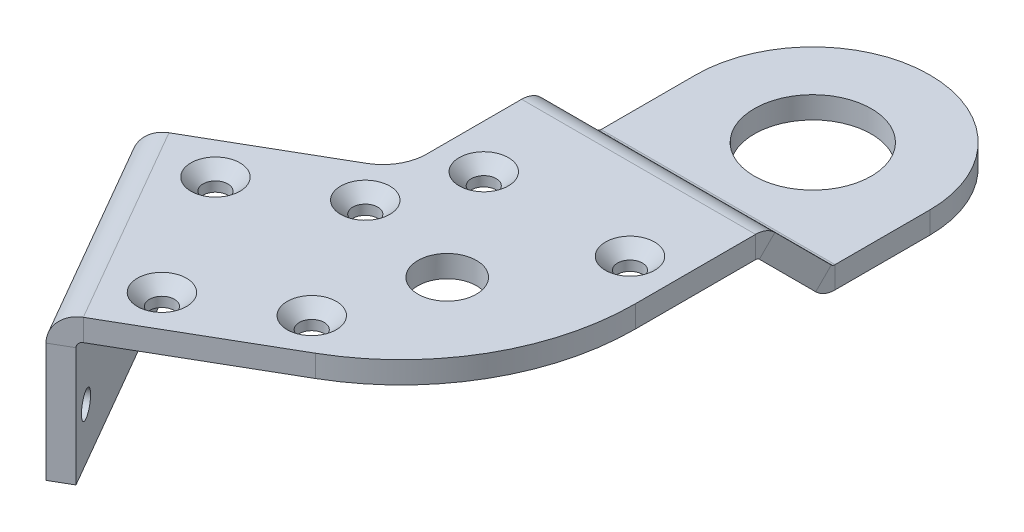
from build123d import *

# Parameters (mm, degrees)
SKETCH2_R                                            = 8
BASE_FLANGE1_DEPTH                                   = 3
EDGE_FLANGE1_START                                   = -16
EDGE_FLANGE1_DEPTH                                   = 32
EDGE_FLANGE1_2_DEPTH                                 = 32
EDGE_FLANGE2_START                                   = -16
EDGE_FLANGE2_DEPTH                                   = 32
EDGE_FLANGE2_2_DEPTH                                 = 32
SKETCH15_R                                           = 4
BOSS_EXTRUDE1_DEPTH                                  = 3
EDGE_FLANGE3_STRIP_W                                 = 13.4732
EDGE_FLANGE3_STRIP_H                                 = 3
EDGE_FLANGE3_STRIP_CUT_DEPTH                         = 32
EDGE_FLANGE3_DEPTH                                   = 32
CSK_FOR_M3_HEX_SOCKET_COUNTERSUNK_CAP_SC_D           = 3.4
CSK_FOR_M3_HEX_SOCKET_COUNTERSUNK_CAP_SC_CSINK_D     = 6.72
CSK_FOR_M3_HEX_SOCKET_COUNTERSUNK_CAP_SC_CSINK_ANGLE = 90
FILLET1_R                                            = 6
M3_CLEARANCE_HOLE1_D                                 = 3.4


# Read off the part's stored shape, not the designer's step: Edge-Flange1, Edge-Flange2
# Sheet-metal steps are written as plain solids
with BuildPart() as part:
    # Sketch2 → Base-Flange1 (new body)
    with BuildSketch(Plane(origin=(0, 0, 0), x_dir=(1, 0, 0), z_dir=(0, 1, 0))):
        with BuildLine():
            Line((-16, 0), (-16, -17.5))
            Line((-16, -17.5), (16, -17.5))
            Line((16, -17.5), (16, 0))
            ThreePointArc((16, 0), (0, 16), (-16, 0))
        make_face()
        with Locations(Location((0, 0, 0), (0, 0, 270))):
            Circle(SKETCH2_R, mode=Mode.SUBTRACT)
    extrude(amount=-BASE_FLANGE1_DEPTH)

    # Edge-Flange1 outline → Edge-Flange1 (cut)
    with BuildSketch(Plane.YZ.offset(EDGE_FLANGE1_START)):
        with BuildLine():
            ThreePointArc((-3, 12.952249603), (-2.715568261, 14.382184516), (-1.905575199, 15.594424801))
            Line((-1.905575199, 15.594424801), (0, 17.5))
            Line((0, 17.5), (-3, 17.5))
            Line((-3, 17.5), (-3, 12.952249603))
        make_face()
    extrude(amount=EDGE_FLANGE1_DEPTH, mode=Mode.SUBTRACT)

    # Edge-Flange1 2 outline → Edge-Flange1 2 (add)
    with BuildSketch(Plane.YZ.offset(EDGE_FLANGE1_START)):
        with BuildLine():
            Line((9.02081528, 26.52081528), (0, 17.5))
            Line((0, 17.5), (0, 12.952249603))
            ThreePointArc((0, 12.952249603), (0.056070336, 13.234134219), (0.215745145, 13.473104458))
            Line((0.215745145, 13.473104458), (11.142135624, 24.399494937))
            Line((11.142135624, 24.399494937), (9.02081528, 26.52081528))
        make_face()
    extrude(amount=EDGE_FLANGE1_2_DEPTH)

    # Edge-Flange2 outline → Edge-Flange2 (cut)
    with BuildSketch(Plane.YZ.offset(EDGE_FLANGE2_START)):
        with BuildLine():
            Line((9.02081528, 26.52081528), (9.02081528, 23.82592499))
            ThreePointArc((9.02081528, 23.82592499), (8.736383541, 22.395990077), (7.926390479, 21.183749792))
            Line((7.926390479, 21.183749792), (11.142135624, 24.399494937))
            Line((11.142135624, 24.399494937), (9.02081528, 26.52081528))
        make_face()
    extrude(amount=EDGE_FLANGE2_DEPTH, mode=Mode.SUBTRACT)

    # Edge-Flange2 2 outline → Edge-Flange2 2 (add)
    with BuildSketch(Plane.YZ.offset(EDGE_FLANGE2_START)):
        with BuildLine():
            Line((5.805070135, 23.305070135), (9.02081528, 26.52081528))
            Line((9.02081528, 26.52081528), (9.02081528, 40.278174593))
            Line((9.02081528, 40.278174593), (6.02081528, 40.278174593))
            Line((6.02081528, 40.278174593), (6.02081528, 23.82592499))
            ThreePointArc((6.02081528, 23.82592499), (5.964744944, 23.544040374), (5.805070135, 23.305070135))
        make_face()
    extrude(amount=EDGE_FLANGE2_2_DEPTH)

    # Sketch15 → Boss-Extrude1 (add)
    with BuildSketch(Plane(origin=(0, 9.02081528, 0), x_dir=(1, 0, 0), z_dir=(0, 1, 0))):
        with BuildLine():
            Line((-16, -40.278174593), (-36.784609691, -52.278174593))
            Line((-36.784609691, -52.278174593), (-20.784609691, -79.990987514))
            Line((-20.784609691, -79.990987514), (0, -67.990987514))
            ThreePointArc((0, -67.990987514), (11.712812921, -56.278174593), (16, -40.278174593))
            Line((16, -40.278174593), (-16, -40.278174593))
        make_face()
        with Locations(Location((0, -50, 0), (0, 0, 270))):
            Circle(SKETCH15_R, mode=Mode.SUBTRACT)
    extrude(amount=-BOSS_EXTRUDE1_DEPTH)

    # Edge-Flange3 strip (across the edge) → Edge-Flange3 strip cut (cut)
    with BuildSketch(Plane(origin=(-20.784609691, 6.02081528, 79.990987514), x_dir=(0.8660254037844396, -3.491481338843133e-15, -0.4999999999999983), z_dir=(-0.4999999999999983, 0, -0.8660254037844396))):
        with Locations((-6, -1.5)):
            Rectangle(EDGE_FLANGE3_STRIP_W, EDGE_FLANGE3_STRIP_H)
    extrude(amount=EDGE_FLANGE3_STRIP_CUT_DEPTH, mode=Mode.SUBTRACT)

    # Edge-Flange3 section (across the edge) → Edge-Flange3 (add)
    with BuildSketch(Plane(origin=(-20.784609691, 6.02081528, 79.990987514), x_dir=(0.8660254037844396, -3.491481338843133e-15, -0.4999999999999983), z_dir=(-0.4999999999999983, 0, -0.8660254037844396))):
        with BuildLine():
            Line((-3, 0.7366), (-3, 17))
            Line((-3, 17), (0, 17))
            Line((0, 17), (0, 0.7366))
            ThreePointArc((0, 0.7366), (0.215745145, 0.215745145), (0.7366, 0))
            Line((0.7366, 0), (0.7366, -3))
            ThreePointArc((0.7366, -3), (-1.905575199, -1.905575199), (-3, 0.7366))
        make_face()
    extrude(amount=EDGE_FLANGE3_DEPTH)

    # CSK for M3 Hex Socket Countersunk Cap Screw1 (through all)
    with Locations(Plane(origin=(0, 9.02081528, 0), x_dir=(1, 0, 0), z_dir=(0, 1, 0))):
        with Locations((-27.722431864, -53.974327016), (-14.732050808, -46.474327016), (-4.732050808, -63.794835091), (-17.722431864, -71.294835091), (-10, -35), (10, -35)):
            CounterSinkHole(CSK_FOR_M3_HEX_SOCKET_COUNTERSUNK_CAP_SC_D / 2, CSK_FOR_M3_HEX_SOCKET_COUNTERSUNK_CAP_SC_CSINK_D / 2, counter_sink_angle=CSK_FOR_M3_HEX_SOCKET_COUNTERSUNK_CAP_SC_CSINK_ANGLE)

    # Fillet1
    fillet1_edges = [part.edges().sort_by_distance(p)[0] for p in [
        (-16, 7.52081528, 40.278174593),
    ]]
    fillet(fillet1_edges, radius=FILLET1_R)

    # M3 Clearance Hole1 (through all)
    with Locations(Plane(origin=(-50.225570899, 0, 28.997746879), x_dir=(-0.49999999999999806, 2.339652494442703e-15, -0.8660254037844398), z_dir=(0.8660254037844397, -4.052396992430042e-15, -0.499999999999998))):
        with Locations((-55.127433482, -3.97918472), (-31.475106897, -3.97918472)):
            Hole(M3_CLEARANCE_HOLE1_D / 2)


solid = part.part
